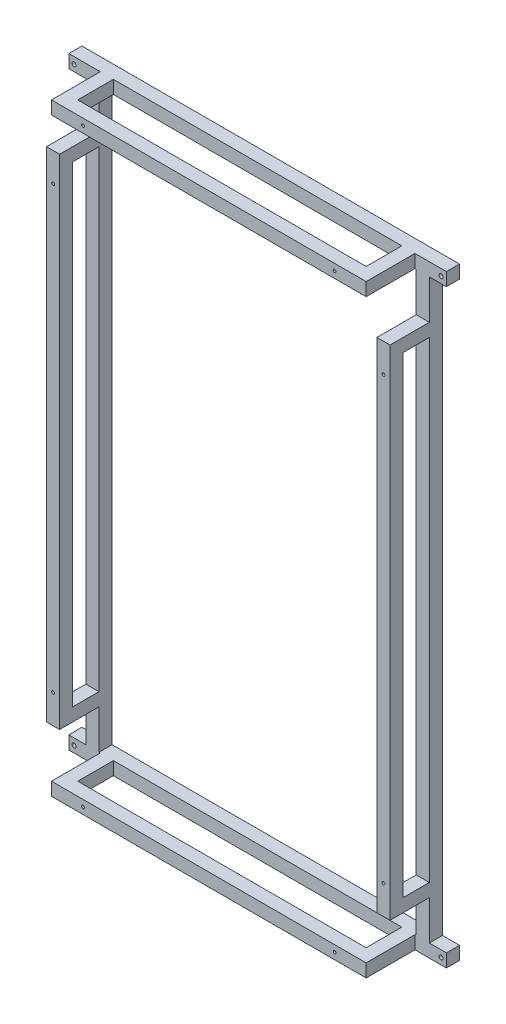
from build123d import *

# Parameters (mm, degrees)
ESQUISSE1_W                  = 720
ESQUISSE1_H                  = 25
BOSS_EXTRU_1_DEPTH           = 25
BOSS_EXTRU_1_2_DEPTH         = 25
ENL_V_MAT_EXTRU_1_DEPTH      = 25
ENL_V_MAT_EXTRU_1_DEPTH_BACK = 100
ESQUISSE2_R                  = 4
ESQUISSE3_W                  = 25
ESQUISSE3_H                  = 25
BOSS_EXTRU_2_DEPTH           = 68
ESQUISSE4_W                  = 600
ESQUISSE4_H                  = 25
BOSS_EXTRU_3_DEPTH           = 25
ESQUISSE5_R                  = 2.75
ENL_V_MAT_EXTRU_2_DEPTH      = 25
ESQUISSE6_W                  = 25
ESQUISSE6_H                  = 1100
BOSS_EXTRU_4_DEPTH           = 25
ESQUISSE7_W                  = 25
ESQUISSE7_H                  = 25
BOSS_EXTRU_5_DEPTH           = 50
ESQUISSE8_W                  = 25
ESQUISSE8_H                  = 950
BOSS_EXTRU_6_DEPTH           = 25
ESQUISSE9_R                  = 2.75
ENL_V_MAT_EXTRU_3_DEPTH      = 25


with BuildPart() as part:
    # Esquisse1 → Boss.-Extru.1 (new body)
    with BuildSketch(Plane.XY):
        with Locations((360, 12.5)):
            Rectangle(ESQUISSE1_W, ESQUISSE1_H)
    extrude(amount=BOSS_EXTRU_1_DEPTH)


with BuildPart() as body_2:
    # Esquisse1 → Boss.-Extru.1 2 (new body)
    with BuildSketch(Plane.XY):
        with Locations((360, -1112.5)):
            Rectangle(ESQUISSE1_W, ESQUISSE1_H)
    extrude(amount=BOSS_EXTRU_1_2_DEPTH)


with BuildPart() as enl_v_mat_extru_1_tool:
    # Esquisse2 → Enlèv. mat.-Extru.1 (new, two sides: drawn at the far end of the back side and taken through both)
    with BuildSketch(Plane.XY.offset(25).offset(-ENL_V_MAT_EXTRU_1_DEPTH_BACK)):
        with Locations((10, 12.5)):
            Circle(ESQUISSE2_R)
        with Locations((710, 12.5)):
            Circle(ESQUISSE2_R)
        with Locations((710, -1112.5)):
            Circle(ESQUISSE2_R)
        with Locations((10, -1112.5)):
            Circle(ESQUISSE2_R)
    extrude(amount=ENL_V_MAT_EXTRU_1_DEPTH + ENL_V_MAT_EXTRU_1_DEPTH_BACK)


with BuildPart() as part_1:
    add(part.part)

    # Enlèv. mat.-Extru.1: cut by enl_v_mat_extru_1_tool
    add(enl_v_mat_extru_1_tool.part, mode=Mode.SUBTRACT)



with BuildPart() as body_2_1:
    add(body_2.part)

    # Enlèv. mat.-Extru.1: cut by enl_v_mat_extru_1_tool
    add(enl_v_mat_extru_1_tool.part, mode=Mode.SUBTRACT)


with BuildPart() as part_2:
    add(part_1.part)

    add(body_2_1.part)  # Boss.-Extru.2 merges body 2
    # Esquisse3 → Boss.-Extru.2 (add)
    with BuildSketch(Plane.XY.offset(25)):
        with Locations((72.5, 12.5)):
            Rectangle(ESQUISSE3_W, ESQUISSE3_H)
        with Locations((647.5, 12.5)):
            Rectangle(ESQUISSE3_W, ESQUISSE3_H)
        with Locations((72.5, -1112.5)):
            Rectangle(ESQUISSE3_W, ESQUISSE3_H)
        with Locations((647.5, -1112.5)):
            Rectangle(ESQUISSE3_W, ESQUISSE3_H)
    extrude(amount=BOSS_EXTRU_2_DEPTH)

    # Esquisse4 → Boss.-Extru.3 (add)
    with BuildSketch(Plane.XY.offset(93)):
        with Locations((360, 12.5)):
            Rectangle(ESQUISSE4_W, ESQUISSE4_H)
        with Locations((360, -1112.5)):
            Rectangle(ESQUISSE4_W, ESQUISSE4_H)
    extrude(amount=BOSS_EXTRU_3_DEPTH)

    # Esquisse5 → Enlèv. mat.-Extru.2 (cut)
    with BuildSketch(Plane.XY.offset(118)):
        with Locations((120, 12.5)):
            Circle(ESQUISSE5_R)
        with Locations((600, 12.5)):
            Circle(ESQUISSE5_R)
        with Locations((600, -1112.5)):
            Circle(ESQUISSE5_R)
        with Locations((120, -1112.5)):
            Circle(ESQUISSE5_R)
    extrude(amount=-ENL_V_MAT_EXTRU_2_DEPTH, mode=Mode.SUBTRACT)

    # Esquisse6 → Boss.-Extru.4 (add)
    with BuildSketch(Plane(origin=(0, 0, 0), x_dir=(-1, 0, 0), z_dir=(0, 0, -1))):
        with Locations((-675, -550)):
            Rectangle(ESQUISSE6_W, ESQUISSE6_H)
        with Locations((-45, -550)):
            Rectangle(ESQUISSE6_W, ESQUISSE6_H)
    extrude(amount=-BOSS_EXTRU_4_DEPTH)

    # Esquisse7 → Boss.-Extru.5 (add)
    with BuildSketch(Plane.XY.offset(25)):
        with Locations((45, -1012.5)):
            Rectangle(ESQUISSE7_W, ESQUISSE7_H)
        with Locations((45, -87.5)):
            Rectangle(ESQUISSE7_W, ESQUISSE7_H)
        with Locations((675, -87.5)):
            Rectangle(ESQUISSE7_W, ESQUISSE7_H)
        with Locations((675, -1012.5)):
            Rectangle(ESQUISSE7_W, ESQUISSE7_H)
    extrude(amount=BOSS_EXTRU_5_DEPTH)

    # Esquisse8 → Boss.-Extru.6 (add)
    with BuildSketch(Plane.XY.offset(75)):
        with Locations((675, -550)):
            Rectangle(ESQUISSE8_W, ESQUISSE8_H)
        with Locations((45, -550)):
            Rectangle(ESQUISSE8_W, ESQUISSE8_H)
    extrude(amount=BOSS_EXTRU_6_DEPTH)

    # Esquisse9 → Enlèv. mat.-Extru.3 (cut)
    with BuildSketch(Plane.XY.offset(100)):
        with Locations((675, -970)):
            Circle(ESQUISSE9_R)
        with Locations((45, -970)):
            Circle(ESQUISSE9_R)
        with Locations((675, -130)):
            Circle(ESQUISSE9_R)
        with Locations((45, -130)):
            Circle(ESQUISSE9_R)
    extrude(amount=-ENL_V_MAT_EXTRU_3_DEPTH, mode=Mode.SUBTRACT)


solid = part_2.part
